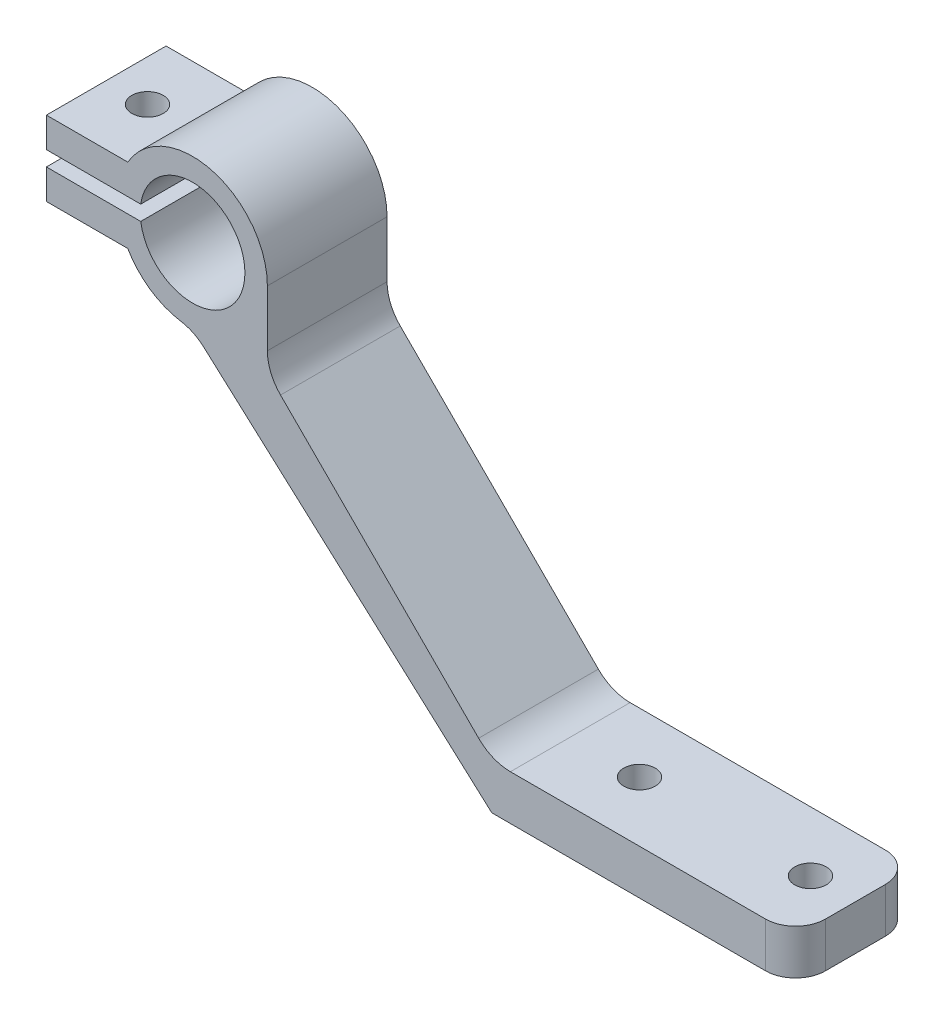
from build123d import *

# Parameters (mm, degrees)
SKETCH1_R                = 1.05
BOSS_EXTRUDE1_DEPTH      = 3
BOSS_EXTRUDE2_DEPTH      = 4
BOSS_EXTRUDE2_DEPTH_BACK = 4
LOFT2_START              = -4
LOFT2_DEPTH              = 8
FILLET1_R                = 3
CUT_EXTRUDE1_DEPTH       = 49.748957751
CUT_EXTRUDE1_DEPTH_BACK  = 49.748957751
SKETCH8_R                = 1.05
CUT_EXTRUDE2_DEPTH       = 0.8


# Read off the part's stored shape, not the designer's step: Loft2
with BuildPart() as part:
    # Sketch1 → Boss-Extrude1 (new body)
    with BuildSketch(Plane(origin=(0, 0, 0), x_dir=(1, 0, 0), z_dir=(0, 1, 0))):
        with BuildLine():
            Line((-6.715, -4), (6.715, -4))
            ThreePointArc((6.715, -4), (8.129213562, -3.414213562), (8.715, -2))
            Line((8.715, -2), (8.715, 2))
            ThreePointArc((8.715, 2), (8.129213562, 3.414213562), (6.715, 4))
            Line((6.715, 4), (-6.715, 4))
            Line((-6.715, 4), (-11.585, 4))
            Line((-11.585, 4), (-11.585, -4))
            Line((-11.585, -4), (-6.715, -4))
        make_face()
        with Locations(Location((-5.715, 0, 0), (0, 0, 270))):
            Circle(SKETCH1_R, mode=Mode.SUBTRACT)
        with Locations(Location((5.715, 0, 0), (0, 0, 270))):
            Circle(SKETCH1_R, mode=Mode.SUBTRACT)
    extrude(amount=BOSS_EXTRUDE1_DEPTH)



with BuildPart() as body_2:
    # Sketch3 → Boss-Extrude2 (new, two sides: drawn at the far end of the back side and taken through both)
    with BuildSketch(Plane.XY.offset(-BOSS_EXTRUDE2_DEPTH_BACK)):
        with BuildLine():
            Line((-41.354696007, 22.5), (-41.354696007, 21.5))
            Line((-41.354696007, 21.5), (-41.354696007, 20.5))
            Line((-41.354696007, 20.5), (-36.354696007, 20.5))
            Line((-36.354696007, 20.5), (-35.915127019, 20.5))
            ThreePointArc((-35.915127019, 20.5), (-34.085, 18.669872981), (-31.585, 18))
            Line((-31.585, 18), (-26.585, 18))
            Line((-26.585, 18), (-26.585, 23))
            ThreePointArc((-26.585, 23), (-30.290904774, 27.829629131), (-35.915127019, 25.5))
            Line((-35.915127019, 25.5), (-36.354696007, 25.5))
            Line((-36.354696007, 25.5), (-41.354696007, 25.5))
            Line((-41.354696007, 25.5), (-41.354696007, 24.5))
            Line((-41.354696007, 24.5), (-41.354696007, 23.5))
            Line((-41.354696007, 23.5), (-36.354696007, 23.5))
            Line((-36.354696007, 23.5), (-35.049101615, 23.5))
            ThreePointArc((-35.049101615, 23.5), (-31.334356481, 26.491013868), (-28.085, 23))
            ThreePointArc((-28.085, 23), (-31.334356481, 19.508986132), (-35.049101615, 22.5))
            Line((-35.049101615, 22.5), (-36.354696007, 22.5))
            Line((-36.354696007, 22.5), (-41.354696007, 22.5))
        make_face()
    extrude(amount=BOSS_EXTRUDE2_DEPTH + BOSS_EXTRUDE2_DEPTH_BACK)


with BuildPart() as part_1:
    add(part.part)

    add(body_2.part)  # Loft2 merges body 2
    # Loft2 outline → Loft2 (add)
    with BuildSketch(Plane.XY.offset(LOFT2_START)):
        Polygon((-11.585, 3), (-26.585, 18), (-31.585, 18), (-11.585, 0), align=None)
    extrude(amount=LOFT2_DEPTH)

    # Fillet1
    fillet1_edges = [part_1.edges().sort_by_distance(p)[0] for p in [
        (-31.585, 18, 0),
        (-26.585, 18, 0),
        (-11.585, 3, 0),
    ]]
    fillet(fillet1_edges, radius=FILLET1_R)

    # Sketch8 → Cut-Extrude1 (cut, two sides: drawn at the far end of the back side and taken through both)
    with BuildSketch(Plane(origin=(0, 25.5, 0), x_dir=(1, 0, 0), z_dir=(0, 1, 0)).offset(-CUT_EXTRUDE1_DEPTH_BACK)):
        with Locations(Location((-38.59424289, 0, 0), (0, 0, 90))):
            Circle(SKETCH8_R)
    extrude(amount=CUT_EXTRUDE1_DEPTH + CUT_EXTRUDE1_DEPTH_BACK, mode=Mode.SUBTRACT)

    # Sketch9 → Cut-Extrude2 (cut)
    with BuildSketch(Plane.XZ.offset(-20.5)):
        Polygon((-36.59424289, 1.154700538), (-38.59424289, 2.309401077), (-40.59424289, 1.154700538), (-40.59424289, -1.154700538), (-38.59424289, -2.309401077), (-36.59424289, -1.154700538), align=None)
    extrude(amount=-CUT_EXTRUDE2_DEPTH, mode=Mode.SUBTRACT)


solid = part_1.part
